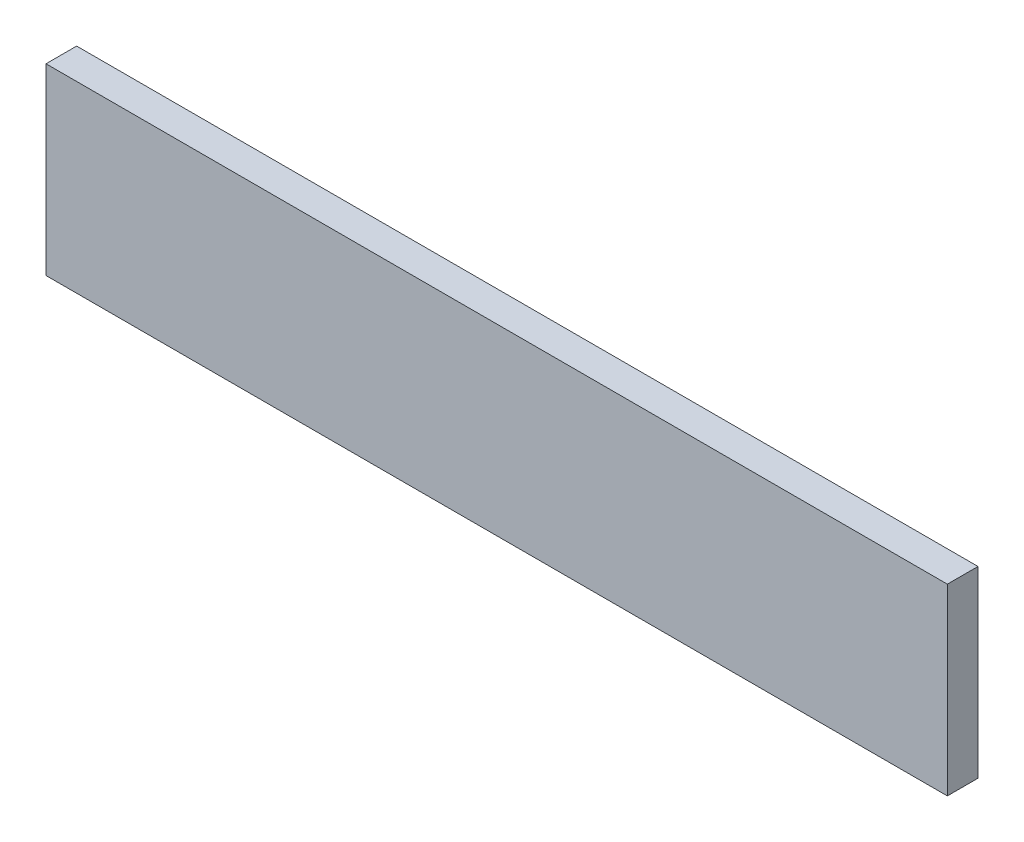
from build123d import *

# Parameters (mm, degrees)
SKETCH1_W           = 294
SKETCH1_H           = 59.82575695
BOSS_EXTRUDE1_DEPTH = 10


with BuildPart() as part:
    # Sketch1 → Boss-Extrude1 (new body)
    with BuildSketch(Plane.XY):
        with Locations((100, 22.912878475)):
            Rectangle(SKETCH1_W, SKETCH1_H)
    extrude(amount=BOSS_EXTRUDE1_DEPTH)


solid = part.part
